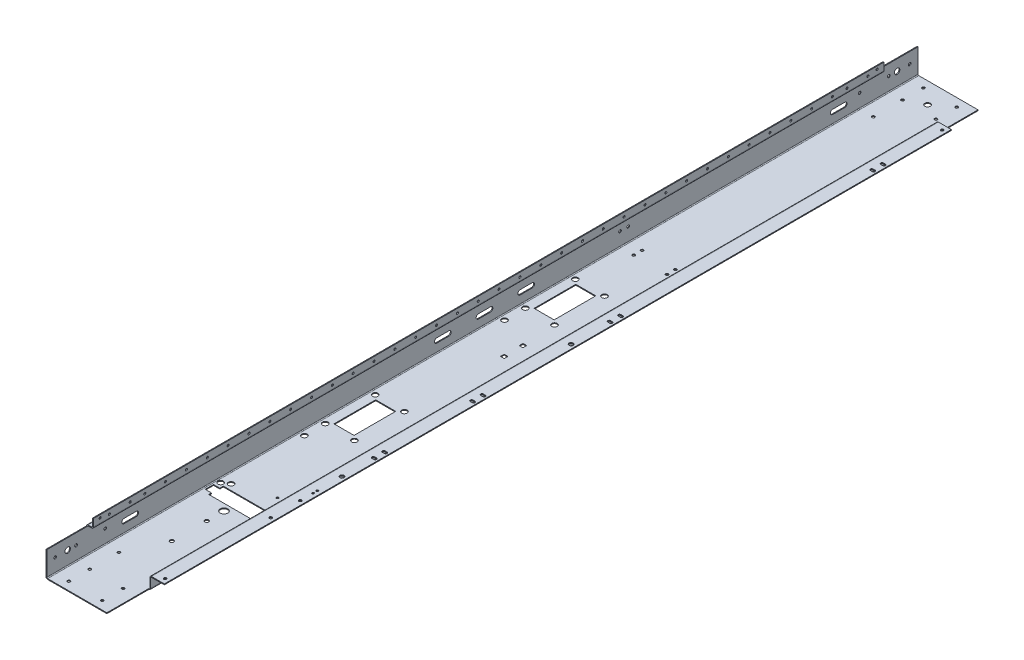
from build123d import *

# Parameters (mm, degrees)
SM_BASE_FLANGE_1_DEPTH  = 1045
SKETCH_6_W              = 101
SKETCH_6_H              = 30
CUT_EXTRUDE_1_DEPTH     = 37
SKETCH_7_W              = 17
SKETCH_7_H              = 97
CUT_EXTRUDE_2_DEPTH     = 24
SKETCH_8_R              = 6.5
SKETCH_8_R_2            = 3.25
CUT_EXTRUDE_3_DEPTH     = 10
SKETCH_9_R              = 3.25
CUT_EXTRUDE_4_DEPTH     = 10
SKETCH_13_R             = 3.25
SKETCH_13_R_2           = 5
CUT_EXTRUDE_6_DEPTH     = 10
CUT_EXTRUDE_3454_DEPTH  = 10
CUT_EXTRUDE_8_DEPTH     = 10
SKETCH_16_R             = 3.25
SKETCH_16_R_2           = 6.5
CUT_EXTRUDE_9_DEPTH     = 10
SKETCH_17_R             = 2.5
CUT_EXTRUDE_10_DEPTH    = 10
SKETCH_21_R             = 2.5
CUT_EXTRUDE_6513_DEPTH  = 10
SKETCH_24_R             = 6.5
SKETCH_24_W             = 48
SKETCH_24_H             = 100
CUT_EXTRUDE_7237_DEPTH  = 10
SKETCH_26_W             = 9
SKETCH_26_H             = 9
CUT_EXTRUDE_8003_DEPTH  = 10
SKETCH_27_R             = 6.5
CUT_EXTRUDE_8690_DEPTH  = 10
SKETCH_28_R             = 4.5
SKETCH_28_R_2           = 9
CUT_EXTRUDE_10_2_DEPTH  = 10
SKETCH_30_R             = 2.5
CUT_EXTRUDE_9976_DEPTH  = 10
CUT_EXTRUDE_10775_DEPTH = 10


# Sheet-metal steps are written as plain solids
with BuildPart() as part:
    # Sketch 1 → Sm Base Flange 1 (new, symmetric)
    with BuildSketch(Plane.XY):
        with BuildLine():
            Line((0, 0), (-31, 0))
            ThreePointArc((-31, 0), (-32.414213562, -0.585786438), (-33, -2))
            Line((-33, -2), (-33, -24))
            ThreePointArc((-33, -24), (-34.171572875, -26.828427125), (-37, -28))
            Line((-37, -28), (-179, -28))
            ThreePointArc((-179, -28), (-181.828427125, -26.828427125), (-183, -24))
            Line((-183, -24), (-183, 33))
            ThreePointArc((-183, 33), (-181.828427125, 35.828427125), (-179, 37))
            Line((-179, 37), (-170, 37))
            ThreePointArc((-170, 37), (-168.585786438, 37.585786438), (-168, 39))
            Line((-168, 39), (-168, 57))
            Line((-168, 57), (-166, 57))
            Line((-166, 57), (-166, 39))
            ThreePointArc((-166, 39), (-167.171572875, 36.171572875), (-170, 35))
            Line((-170, 35), (-179, 35))
            ThreePointArc((-179, 35), (-180.414213562, 34.414213562), (-181, 33))
            Line((-181, 33), (-181, -24))
            ThreePointArc((-181, -24), (-180.414213562, -25.414213562), (-179, -26))
            Line((-179, -26), (-37, -26))
            ThreePointArc((-37, -26), (-35.585786438, -25.414213562), (-35, -24))
            Line((-35, -24), (-35, -2))
            ThreePointArc((-35, -2), (-33.828427125, 0.828427125), (-31, 2))
            Line((-31, 2), (0, 2))
            Line((0, 2), (0, 0))
        make_face()
    extrude(amount=SM_BASE_FLANGE_1_DEPTH, both=True)

    # Эскиз6 → Вырез-Вытянуть1 (cut)
    with BuildSketch(Plane(origin=(0, 0, 0), x_dir=(0, 0, -1), z_dir=(1, 0, 0))):
        with Locations((-994.5, -13)):
            Rectangle(SKETCH_6_W, SKETCH_6_H)
        with Locations((994.5, -13)):
            Rectangle(SKETCH_6_W, SKETCH_6_H)
    extrude(amount=-CUT_EXTRUDE_1_DEPTH, mode=Mode.SUBTRACT)

    # Эскиз7 → Вырез-Вытянуть2 (cut)
    with BuildSketch(Plane(origin=(0, 57, 0), x_dir=(1, 0, 0), z_dir=(0, 1, 0))):
        with Locations((-174.5, -996.5)):
            Rectangle(SKETCH_7_W, SKETCH_7_H)
        with Locations((-174.5, 996.5)):
            Rectangle(SKETCH_7_W, SKETCH_7_H)
    extrude(amount=-CUT_EXTRUDE_2_DEPTH, mode=Mode.SUBTRACT)

    # Эскиз8 → Вырез-Вытянуть3 (cut)
    with BuildSketch(Plane(origin=(0, -26, 0), x_dir=(1, 0, 0), z_dir=(0, 1, 0))):
        with Locations(Location((-108, 995, 0), (0, 0, 180))):
            Circle(SKETCH_8_R)
        with Locations(Location((-68, 1025, 0), (0, 0, 180))):
            Circle(SKETCH_8_R_2)
        with Locations(Location((-148, 1025, 0), (0, 0, 180))):
            Circle(SKETCH_8_R_2)
        with Locations(Location((-148, 975, 0), (0, 0, 180))):
            Circle(SKETCH_8_R_2)
        with Locations(Location((-68, 975, 0), (0, 0, 180))):
            Circle(SKETCH_8_R_2)
        with Locations(Location((-148, 905, 0), (0, 0, 180))):
            Circle(SKETCH_8_R_2)
        with Locations((-148, -905)):
            Circle(SKETCH_8_R_2)
        with Locations((-148, -1025)):
            Circle(SKETCH_8_R_2)
        with Locations((-148, -975)):
            Circle(SKETCH_8_R_2)
        with Locations((-68, -975)):
            Circle(SKETCH_8_R_2)
        with Locations((-68, -1025)):
            Circle(SKETCH_8_R_2)
    extrude(amount=-CUT_EXTRUDE_3_DEPTH, mode=Mode.SUBTRACT)

    # Эскиз9 → Вырез-Вытянуть4 (cut)
    with BuildSketch(Plane(origin=(0, -26, 0), x_dir=(1, 0, 0), z_dir=(0, 1, 0))):
        with Locations(Location((-68, 350, 0), (0, 0, 180))):
            Circle(SKETCH_9_R)
        with Locations(Location((-148, 350, 0), (0, 0, 180))):
            Circle(SKETCH_9_R)
        with Locations(Location((-148, 330, 0), (0, 0, 180))):
            Circle(SKETCH_9_R)
        with Locations(Location((-68, 330, 0), (0, 0, 180))):
            Circle(SKETCH_9_R)
    cut_extrude_4 = extrude(amount=-CUT_EXTRUDE_4_DEPTH, mode=Mode.SUBTRACT)

    # Зеркальное отражение1: Вырез-Вытянуть4 across plane
    add(cut_extrude_4.mirror(Plane(origin=(-77.5, 77.5, 0), x_dir=(0, 0, 1), z_dir=(-0.7071067811865476, 0.7071067811865475, 0))), mode=Mode.SUBTRACT)

    # Эскиз13 → Вырез-Вытянуть6 (cut)
    with BuildSketch(Plane.XZ):
        with Locations(Location((-10, -932, 0), (0, 0, 270))):
            Circle(SKETCH_13_R)
        with Locations(Location((-10, 932, 0), (0, 0, 270))):
            Circle(SKETCH_13_R)
        with Locations(Location((-10, 679, 0), (0, 0, 270))):
            Circle(SKETCH_13_R)
        with Locations(Location((-10, 608, 0), (0, 0, 270))):
            Circle(SKETCH_13_R)
        with Locations(Location((-10, 508, 0), (0, 0, 270))):
            Circle(SKETCH_13_R_2)
        with Locations(Location((-10, -42, 0), (0, 0, 270))):
            Circle(SKETCH_13_R_2)
    extrude(amount=-CUT_EXTRUDE_6_DEPTH, mode=Mode.SUBTRACT)

    # Эскиз14 → Cut-Extrude 3454 (cut)
    with BuildSketch(Plane.XZ):
        with BuildLine():
            Line((-12, 434.25), (-7, 434.25))
            ThreePointArc((-7, 434.25), (-3.75, 431), (-7, 427.75))
            Line((-7, 427.75), (-12, 427.75))
            ThreePointArc((-12, 427.75), (-15.25, 431), (-12, 434.25))
        make_face()
        with BuildLine():
            Line((-12, 409.25), (-7, 409.25))
            ThreePointArc((-7, 409.25), (-3.75, 406), (-7, 402.75))
            Line((-7, 402.75), (-12, 402.75))
            ThreePointArc((-12, 402.75), (-15.25, 406), (-12, 409.25))
        make_face()
        with BuildLine():
            Line((-12, 198.25), (-7, 198.25))
            ThreePointArc((-7, 198.25), (-3.75, 195), (-7, 191.75))
            Line((-7, 191.75), (-12, 191.75))
            ThreePointArc((-12, 191.75), (-15.25, 195), (-12, 198.25))
        make_face()
        with BuildLine():
            Line((-12, 173.25), (-7, 173.25))
            ThreePointArc((-7, 173.25), (-3.75, 170), (-7, 166.75))
            Line((-7, 166.75), (-12, 166.75))
            ThreePointArc((-12, 166.75), (-15.25, 170), (-12, 173.25))
        make_face()
        with BuildLine():
            Line((-12, -131.75), (-7, -131.75))
            ThreePointArc((-7, -131.75), (-3.75, -135), (-7, -138.25))
            Line((-7, -138.25), (-12, -138.25))
            ThreePointArc((-12, -138.25), (-15.25, -135), (-12, -131.75))
        make_face()
        with BuildLine():
            Line((-12, -156.75), (-7, -156.75))
            ThreePointArc((-7, -156.75), (-3.75, -160), (-7, -163.25))
            Line((-7, -163.25), (-12, -163.25))
            ThreePointArc((-12, -163.25), (-15.25, -160), (-12, -156.75))
        make_face()
        with BuildLine():
            Line((-12, -761.75), (-7, -761.75))
            ThreePointArc((-7, -761.75), (-3.75, -765), (-7, -768.25))
            Line((-7, -768.25), (-12, -768.25))
            ThreePointArc((-12, -768.25), (-15.25, -765), (-12, -761.75))
        make_face()
        with BuildLine():
            Line((-12, -786.75), (-7, -786.75))
            ThreePointArc((-7, -786.75), (-3.75, -790), (-7, -793.25))
            Line((-7, -793.25), (-12, -793.25))
            ThreePointArc((-12, -793.25), (-15.25, -790), (-12, -786.75))
        make_face()
    extrude(amount=-CUT_EXTRUDE_3454_DEPTH, mode=Mode.SUBTRACT)

    # Эскиз15 → Вырез-Вытянуть8 (cut)
    with BuildSketch(Plane.ZY.offset(183)):
        with BuildLine():
            Line((-869.5, 5.5), (-840.5, 5.5))
            ThreePointArc((-840.5, 5.5), (-835, 0), (-840.5, -5.5))
            Line((-840.5, -5.5), (-869.5, -5.5))
            ThreePointArc((-869.5, -5.5), (-875, 0), (-869.5, 5.5))
        make_face()
        with BuildLine():
            Line((-90.5, -5.5), (-119.5, -5.5))
            ThreePointArc((-119.5, -5.5), (-125, 0), (-119.5, 5.5))
            Line((-119.5, 5.5), (-90.5, 5.5))
            ThreePointArc((-90.5, 5.5), (-85, 0), (-90.5, -5.5))
        make_face()
        with BuildLine():
            Line((9.5, -5.5), (-19.5, -5.5))
            ThreePointArc((-19.5, -5.5), (-25, 0), (-19.5, 5.5))
            Line((-19.5, 5.5), (9.5, 5.5))
            ThreePointArc((9.5, 5.5), (15, 0), (9.5, -5.5))
        make_face()
        with BuildLine():
            Line((109.5, -5.5), (80.5, -5.5))
            ThreePointArc((80.5, -5.5), (75, 0), (80.5, 5.5))
            Line((80.5, 5.5), (109.5, 5.5))
            ThreePointArc((109.5, 5.5), (115, 0), (109.5, -5.5))
        make_face()
        with BuildLine():
            Line((859.5, -5.5), (830.5, -5.5))
            ThreePointArc((830.5, -5.5), (825, 0), (830.5, 5.5))
            Line((830.5, 5.5), (859.5, 5.5))
            ThreePointArc((859.5, 5.5), (865, 0), (859.5, -5.5))
        make_face()
    extrude(amount=-CUT_EXTRUDE_8_DEPTH, mode=Mode.SUBTRACT)

    # Эскиз16 → Вырез-Вытянуть9 (cut)
    with BuildSketch(Plane.ZY.offset(183)):
        with Locations((1025, 7)):
            Circle(SKETCH_16_R)
        with Locations((995, 7)):
            Circle(SKETCH_16_R_2)
        with Locations((975, 7)):
            Circle(SKETCH_16_R)
        with Locations((905, 7)):
            Circle(SKETCH_16_R)
        with Locations(Location((-905, 7, 0), (0, 0, 180))):
            Circle(SKETCH_16_R)
        with Locations(Location((-975, 7, 0), (0, 0, 180))):
            Circle(SKETCH_16_R)
        with Locations(Location((-995, 7, 0), (0, 0, 180))):
            Circle(SKETCH_16_R_2)
        with Locations(Location((-1025, 7, 0), (0, 0, 180))):
            Circle(SKETCH_16_R)
    extrude(amount=-CUT_EXTRUDE_9_DEPTH, mode=Mode.SUBTRACT)

    # Эскиз17 → Cut-Extrude 10 (cut)
    with BuildSketch(Plane.ZY.offset(168)):
        with Locations((910, 47)):
            Circle(SKETCH_17_R)
        with Locations((860, 47)):
            Circle(SKETCH_17_R)
        with Locations((-860, 47)):
            Circle(SKETCH_17_R)
        with Locations((-910, 47)):
            Circle(SKETCH_17_R)
        with Locations((-932, 50)):
            Circle(SKETCH_17_R)
        with Locations((932, 50)):
            Circle(SKETCH_17_R)
        with Locations((-825, 47)):
            Circle(SKETCH_17_R)
        with Locations((-775, 47)):
            Circle(SKETCH_17_R)
        with Locations((-725, 47)):
            Circle(SKETCH_17_R)
        with Locations((-675, 47)):
            Circle(SKETCH_17_R)
        with Locations((-625, 47)):
            Circle(SKETCH_17_R)
        with Locations((-575, 47)):
            Circle(SKETCH_17_R)
        with Locations((-525, 47)):
            Circle(SKETCH_17_R)
        with Locations((-475, 47)):
            Circle(SKETCH_17_R)
        with Locations((-425, 47)):
            Circle(SKETCH_17_R)
        with Locations((-375, 47)):
            Circle(SKETCH_17_R)
        with Locations((-325, 47)):
            Circle(SKETCH_17_R)
        with Locations((-275, 47)):
            Circle(SKETCH_17_R)
        with Locations((-225, 47)):
            Circle(SKETCH_17_R)
        with Locations((-175, 47)):
            Circle(SKETCH_17_R)
        with Locations((-125, 47)):
            Circle(SKETCH_17_R)
        with Locations((-75, 47)):
            Circle(SKETCH_17_R)
        with Locations((-25, 47)):
            Circle(SKETCH_17_R)
        with Locations((25, 47)):
            Circle(SKETCH_17_R)
        with Locations((75, 47)):
            Circle(SKETCH_17_R)
        with Locations((125, 47)):
            Circle(SKETCH_17_R)
        with Locations((175, 47)):
            Circle(SKETCH_17_R)
        with Locations((225, 47)):
            Circle(SKETCH_17_R)
        with Locations((275, 47)):
            Circle(SKETCH_17_R)
        with Locations((325, 47)):
            Circle(SKETCH_17_R)
        with Locations((375, 47)):
            Circle(SKETCH_17_R)
        with Locations((425, 47)):
            Circle(SKETCH_17_R)
        with Locations((475, 47)):
            Circle(SKETCH_17_R)
        with Locations((525, 47)):
            Circle(SKETCH_17_R)
        with Locations((575, 47)):
            Circle(SKETCH_17_R)
        with Locations((625, 47)):
            Circle(SKETCH_17_R)
        with Locations((675, 47)):
            Circle(SKETCH_17_R)
        with Locations((725, 47)):
            Circle(SKETCH_17_R)
        with Locations((775, 47)):
            Circle(SKETCH_17_R)
        with Locations((825, 47)):
            Circle(SKETCH_17_R)
    extrude(amount=-CUT_EXTRUDE_10_DEPTH, mode=Mode.SUBTRACT)

    # Эскиз21 → Cut-Extrude 6513 (cut)
    with BuildSketch(Plane(origin=(0, 2, 0), x_dir=(1, 0, 0), z_dir=(0, 1, 0))):
        with Locations(Location((-10, -567, 0), (0, 0, 270))):
            Circle(SKETCH_21_R)
        with Locations(Location((-10, -577, 0), (0, 0, 270))):
            Circle(SKETCH_21_R)
    extrude(amount=-CUT_EXTRUDE_6513_DEPTH, mode=Mode.SUBTRACT)

    # Эскиз24 → Cut-Extrude 7237 (cut)
    with BuildSketch(Plane.XZ.offset(28)):
        with Locations((-98, -90)):
            Circle(SKETCH_24_R)
        with Locations((-168, -90)):
            Circle(SKETCH_24_R)
        with Locations((-168, -210)):
            Circle(SKETCH_24_R)
        with Locations((-98, -210)):
            Circle(SKETCH_24_R)
        with Locations((-168, -40)):
            Circle(SKETCH_24_R)
        with Locations((-98, 390)):
            Circle(SKETCH_24_R)
        with Locations((-168, 390)):
            Circle(SKETCH_24_R)
        with Locations((-168, 270)):
            Circle(SKETCH_24_R)
        with Locations((-98, 270)):
            Circle(SKETCH_24_R)
        with Locations((-168, 440)):
            Circle(SKETCH_24_R)
        with Locations((-133, -150)):
            Rectangle(SKETCH_24_W, SKETCH_24_H)
        with Locations((-133, 330)):
            Rectangle(SKETCH_24_W, SKETCH_24_H)
    extrude(amount=-CUT_EXTRUDE_7237_DEPTH, mode=Mode.SUBTRACT)

    # Эскиз26 → Cut-Extrude 8003 (cut)
    with BuildSketch(Plane.XZ.offset(28)):
        with Locations((-93, -9.25)):
            Rectangle(SKETCH_26_W, SKETCH_26_H)
        with Locations((-93, 35.75)):
            Rectangle(SKETCH_26_W, SKETCH_26_H)
    extrude(amount=-CUT_EXTRUDE_8003_DEPTH, mode=Mode.SUBTRACT)

    # Эскиз27 → Cut-Extrude 8690 (cut)
    with BuildSketch(Plane.XZ.offset(28)):
        with Locations((-171, 638)):
            Circle(SKETCH_27_R)
        with Locations((-156, 628)):
            Circle(SKETCH_27_R)
    extrude(amount=-CUT_EXTRUDE_8690_DEPTH, mode=Mode.SUBTRACT)

    # Эскиз28 → Cut-Extrude 10 2 (cut)
    with BuildSketch(Plane.XZ.offset(28)):
        with Locations((-108, 818)):
            Circle(SKETCH_28_R)
        with Locations((-108, 734.5)):
            Circle(SKETCH_28_R)
        with Locations((-108, 693)):
            Circle(SKETCH_28_R_2)
    extrude(amount=-CUT_EXTRUDE_10_2_DEPTH, mode=Mode.SUBTRACT)

    # Эскиз30 → Cut-Extrude 9976 (cut)
    with BuildSketch(Plane.XZ.offset(28)):
        with Locations((-71, 601.5)):
            Circle(SKETCH_30_R)
        with Locations((-55, 601.5)):
            Circle(SKETCH_30_R)
    extrude(amount=-CUT_EXTRUDE_9976_DEPTH, mode=Mode.SUBTRACT)

    # Эскиз31 → Cut-Extrude 10775 (cut)
    with BuildSketch(Plane.XZ.offset(28)):
        Polygon((-160.5, 677), (-55.5, 677), (-55.5, 670.5), (-40.5, 670.5), (-40.5, 650.5), (-55.5, 650.5), (-55.5, 642), (-160.5, 642), (-160.5, 650.5), (-175.5, 650.5), (-175.5, 670.5), (-160.5, 670.5), align=None)
    extrude(amount=-CUT_EXTRUDE_10775_DEPTH, mode=Mode.SUBTRACT)


solid = part.part
